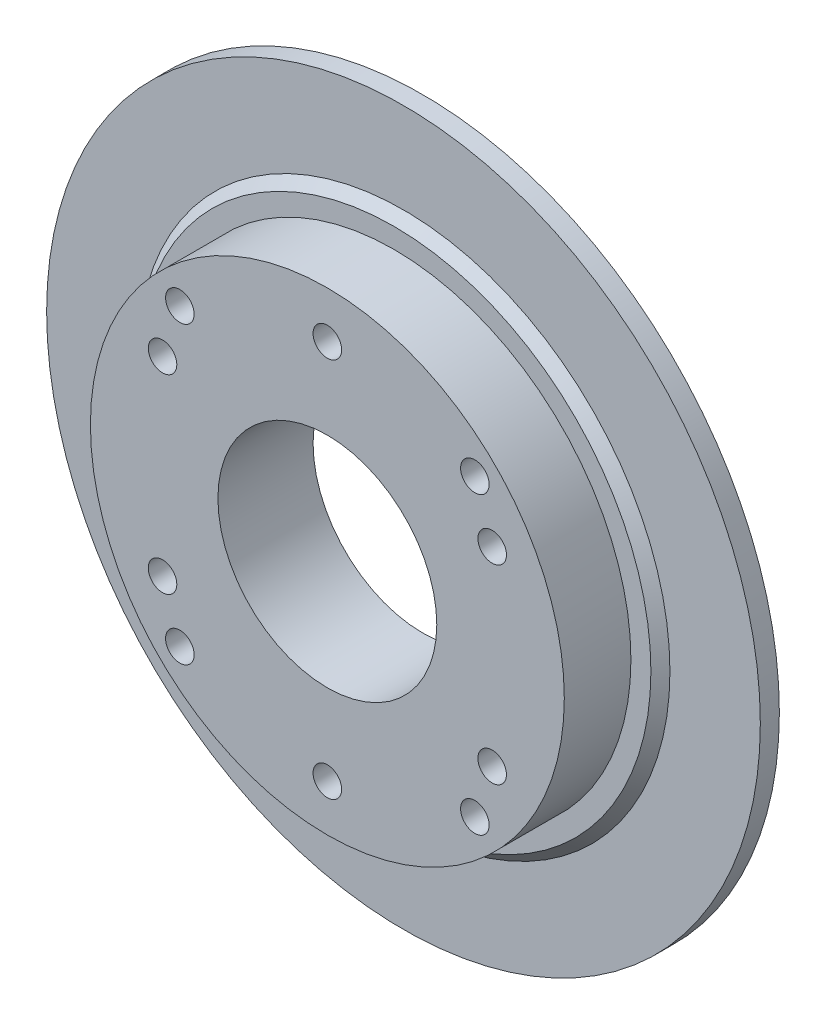
from build123d import *

# Parameters (mm, degrees)
SKETCH1_R           = 37.5
BOSS_EXTRUDE1_DEPTH = 2
SKETCH5_R           = 28
BOSS_EXTRUDE5_DEPTH = 1
SKETCH2_R           = 24.9
BOSS_EXTRUDE2_DEPTH = 7
SKETCH3_R           = 11.5
CUT_EXTRUDE1_DEPTH  = 54.967582862
SKETCH4_R           = 1.5
CUT_EXTRUDE2_DEPTH  = 54.967582862
CHAMFER1_SIZE       = 1
SKETCH6_R           = 1.5
CUT_EXTRUDE3_DEPTH  = 3


with BuildPart() as part:
    # Sketch1 → Boss-Extrude1 (new body)
    with BuildSketch(Plane.XY):
        Circle(SKETCH1_R)
    extrude(amount=BOSS_EXTRUDE1_DEPTH)

    # Sketch5 → Boss-Extrude5 (add)
    with BuildSketch(Plane.XY.offset(2)):
        Circle(SKETCH5_R)
    extrude(amount=BOSS_EXTRUDE5_DEPTH)

    # Sketch2 → Boss-Extrude2 (add)
    with BuildSketch(Plane.XY.offset(3)):
        Circle(SKETCH2_R)
    extrude(amount=BOSS_EXTRUDE2_DEPTH)

    # Sketch3 → Cut-Extrude1 (cut, through all)
    with BuildSketch(Plane.XY.offset(10)):
        Circle(SKETCH3_R)
    extrude(amount=-CUT_EXTRUDE1_DEPTH, mode=Mode.SUBTRACT)

    # Sketch4 → Cut-Extrude2 (cut, through all)
    with BuildSketch(Plane.XY.offset(10)):
        with Locations((-15.5, 15.5)):
            Circle(SKETCH4_R)
        with Locations((15.5, 15.5)):
            Circle(SKETCH4_R)
        with Locations((15.5, -15.5)):
            Circle(SKETCH4_R)
        with Locations((-15.5, -15.5)):
            Circle(SKETCH4_R)
    extrude(amount=-CUT_EXTRUDE2_DEPTH, mode=Mode.SUBTRACT)

    # Chamfer1
    chamfer1_edges = [part.edges().sort_by_distance(p)[0] for p in [
        (-28, 0, 3),
    ]]
    chamfer(chamfer1_edges, length=CHAMFER1_SIZE - 0.0001)  # a hair under: the kernel refuses the full size

    # Sketch6 → Cut-Extrude3 (cut)
    with BuildSketch(Plane.XY.offset(10)):
        with Locations((0, 20)):
            Circle(SKETCH6_R)
        with Locations((-17.320508076, -10)):
            Circle(SKETCH6_R)
        with Locations((0, -20)):
            Circle(SKETCH6_R)
        with Locations((17.320508076, -10)):
            Circle(SKETCH6_R)
        with Locations((17.320508076, 10)):
            Circle(SKETCH6_R)
        with Locations((-17.320508076, 10)):
            Circle(SKETCH6_R)
    extrude(amount=-CUT_EXTRUDE3_DEPTH, mode=Mode.SUBTRACT)


solid = part.part
